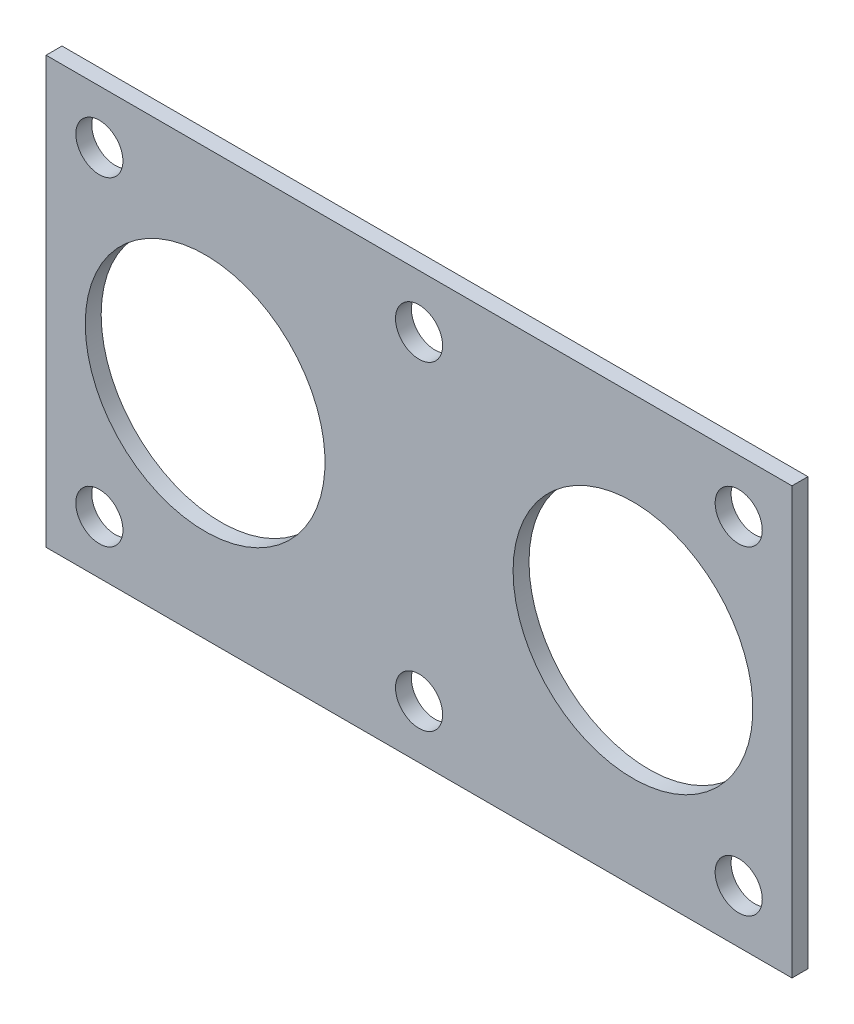
from build123d import *

# Parameters (mm, degrees)
SKETCH1_W              = 88.9
SKETCH1_H              = 50.8
SKETCH1_R              = 14.2875
BOSS_EXTRUDE1_DEPTH    = 1.89738
F_10_CLEARANCE_HOLE1_D = 5.6134


with BuildPart() as part:
    # Sketch1 → Boss-Extrude1 (new body)
    with BuildSketch(Plane.XY):
        with Locations((25.49525, 0)):
            Rectangle(SKETCH1_W, SKETCH1_H)
        Circle(SKETCH1_R, mode=Mode.SUBTRACT)
        with Locations((50.9905, 0)):
            Circle(SKETCH1_R, mode=Mode.SUBTRACT)
    extrude(amount=BOSS_EXTRUDE1_DEPTH)

    # #10 Clearance Hole1 (through all)
    with Locations(Plane(origin=(-41.275, -44.45, 1.89738), x_dir=(1, 0, 0), z_dir=(0, 0, 1))):
        with Locations((104.87025, 63.5), (28.67025, 63.5), (66.77025, 25.4), (28.67025, 25.4), (66.77025, 63.5), (104.87025, 25.4)):
            Hole(F_10_CLEARANCE_HOLE1_D / 2)


solid = part.part
